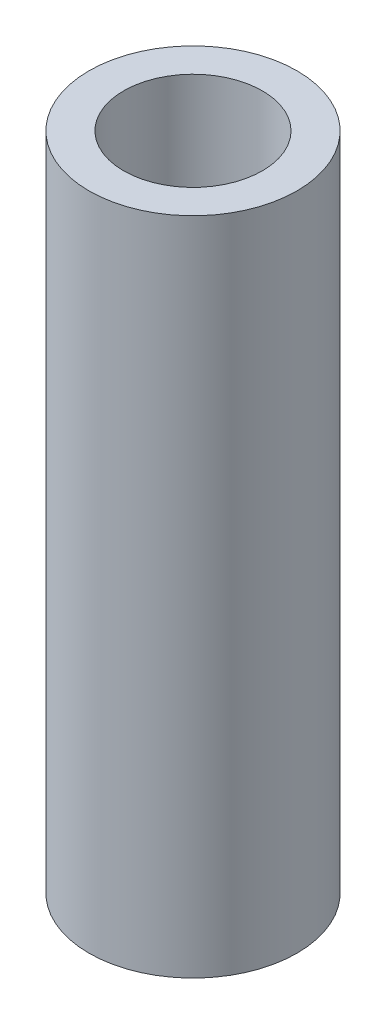
from build123d import *

# Parameters (mm, degrees)
SKETCH1_R           = 4.7625
SKETCH1_R_2         = 3.175
BOSS_EXTRUDE1_DEPTH = 30.226


with BuildPart() as part:
    # Sketch1 → Boss-Extrude1 (new body)
    with BuildSketch(Plane(origin=(0, 0, 0), x_dir=(1, 0, 0), z_dir=(0, 1, 0))):
        Circle(SKETCH1_R)
        Circle(SKETCH1_R_2, mode=Mode.SUBTRACT)
    extrude(amount=BOSS_EXTRUDE1_DEPTH)


solid = part.part
